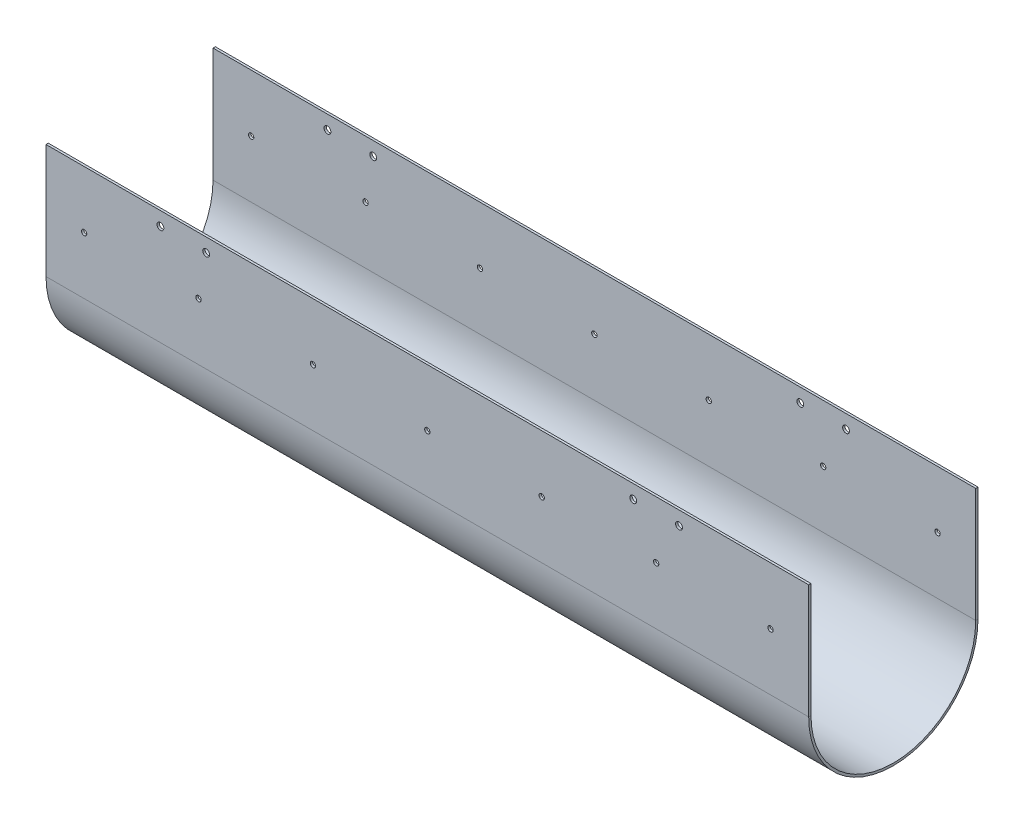
from build123d import *

# Parameters (mm, degrees)
OTHER_START              = -500
OTHER_2_DEPTH            = 1000
CUT_EXTRUDE_4_DEPTH      = 534.686237409
CUT_EXTRUDE_4_DEPTH_BACK = 534.686237409
SKETCH_13_R              = 3.5
SKETCH_13_R_2            = 4.5


# Read off the part's stored shape, not the designer's step: Элемент по сечениям сгиба2
with BuildPart() as part:
    # Other 2 outline → Other 2 (new body)
    with BuildSketch(Plane.YZ.offset(OTHER_START)):
        with BuildLine():
            Line((0, -111), (150, -111))
            Line((150, -111), (150, -108))
            Line((150, -108), (0, -108))
            ThreePointArc((0, -108), (-108, 0), (0, 108))
            Line((0, 108), (150, 108))
            Line((150, 108), (150, 111))
            Line((150, 111), (0, 111))
            ThreePointArc((0, 111), (-111, 0), (0, -111))
        make_face()
    extrude(amount=OTHER_2_DEPTH)

    # Эскиз13 → Вырез-Вытянуть4 (cut, two sides: drawn at the far end of the back side and taken through both)
    with BuildSketch(Plane.XY.offset(-CUT_EXTRUDE_4_DEPTH_BACK)):
        with Locations((450, 75)):
            Circle(SKETCH_13_R)
        with Locations((300, 75)):
            Circle(SKETCH_13_R)
        with Locations((150, 75)):
            Circle(SKETCH_13_R)
        with Locations((0, 75)):
            Circle(SKETCH_13_R)
        with Locations((-150, 75)):
            Circle(SKETCH_13_R)
        with Locations((-300, 75)):
            Circle(SKETCH_13_R)
        with Locations((-450, 75)):
            Circle(SKETCH_13_R)
        with Locations((330, 132)):
            Circle(SKETCH_13_R_2)
        with Locations((270, 132)):
            Circle(SKETCH_13_R_2)
        with Locations((-350, 132)):
            Circle(SKETCH_13_R_2)
        with Locations((-290, 132)):
            Circle(SKETCH_13_R_2)
    extrude(amount=CUT_EXTRUDE_4_DEPTH + CUT_EXTRUDE_4_DEPTH_BACK, mode=Mode.SUBTRACT)


solid = part.part
